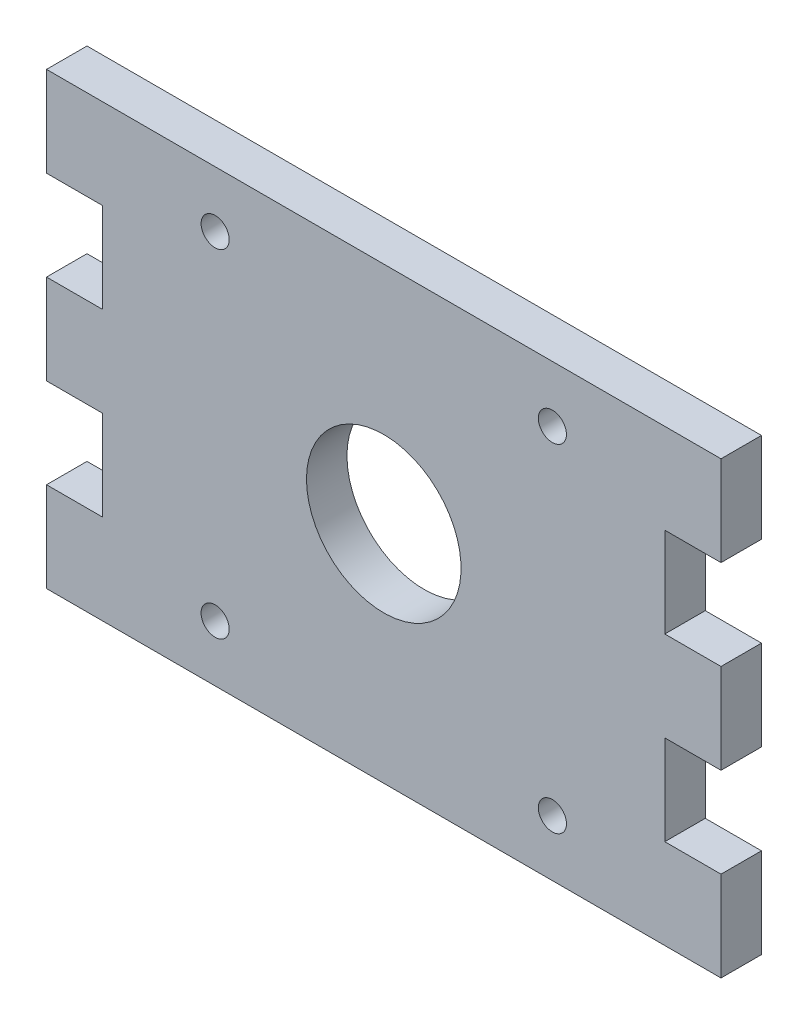
from build123d import *

# Parameters (mm, degrees)
SKETCH1_W           = 76.2
SKETCH1_H           = 50.8
BOSS_EXTRUDE1_DEPTH = 4.572
SKETCH2_R           = 8.73125
CUT_EXTRUDE7_DEPTH  = 92.695055396
SKETCH5_R           = 1.5875
CUT_EXTRUDE8_DEPTH  = 92.695055396
CAVITY1_START       = 10.16
CAVITY1_OUTLINE_W   = 6.35
CAVITY1_OUTLINE_H   = 4.572
CAVITY1_DEPTH       = 10.16
CAVITY1_START_2     = 30.48
CAVITY1_2_OUTLINE_W = 6.35
CAVITY1_2_OUTLINE_H = 4.572
CAVITY1_2_DEPTH     = 10.16


# Read off the part's stored shape, not the designer's step: Cavity1
with BuildPart() as part:
    # Sketch1 → Boss-Extrude1 (new body)
    with BuildSketch(Plane.XY):
        with Locations((38.1, 25.4)):
            Rectangle(SKETCH1_W, SKETCH1_H)
    extrude(amount=BOSS_EXTRUDE1_DEPTH)

    # Sketch2 → Cut-Extrude7 (cut, through all)
    with BuildSketch(Plane(origin=(0, 0, 0), x_dir=(-1, 0, 0), z_dir=(0, 0, -1))):
        with Locations((-38.1, 25.4)):
            Circle(SKETCH2_R)
    extrude(amount=-CUT_EXTRUDE7_DEPTH, mode=Mode.SUBTRACT)

    # Sketch5 → Cut-Extrude8 (cut, through all)
    with BuildSketch(Plane(origin=(0, 0, 0), x_dir=(-1, 0, 0), z_dir=(0, 0, -1))):
        with Locations((-19.05, 44.45)):
            Circle(SKETCH5_R)
        with Locations((-19.05, 6.35)):
            Circle(SKETCH5_R)
        with Locations((-57.15, 44.45)):
            Circle(SKETCH5_R)
        with Locations((-57.15, 6.35)):
            Circle(SKETCH5_R)
    extrude(amount=-CUT_EXTRUDE8_DEPTH, mode=Mode.SUBTRACT)

    # Cavity1 outline → Cavity1 (cut)
    with BuildSketch(Plane(origin=(0, 0, 0), x_dir=(1, 0, 0), z_dir=(0, 1, 0)).offset(CAVITY1_START)):
        with Locations((3.175, -2.286)):
            Rectangle(CAVITY1_OUTLINE_W, CAVITY1_OUTLINE_H)
        with Locations((73.025, -2.286)):
            Rectangle(CAVITY1_OUTLINE_W, CAVITY1_OUTLINE_H)
    extrude(amount=CAVITY1_DEPTH, mode=Mode.SUBTRACT)

    # Cavity1 2 outline → Cavity1 2 (cut)
    with BuildSketch(Plane(origin=(0, 0, 0), x_dir=(1, 0, 0), z_dir=(0, 1, 0)).offset(CAVITY1_START_2)):
        with Locations((3.175, -2.286)):
            Rectangle(CAVITY1_2_OUTLINE_W, CAVITY1_2_OUTLINE_H)
        with Locations((73.025, -2.286)):
            Rectangle(CAVITY1_2_OUTLINE_W, CAVITY1_2_OUTLINE_H)
    extrude(amount=CAVITY1_2_DEPTH, mode=Mode.SUBTRACT)


solid = part.part
